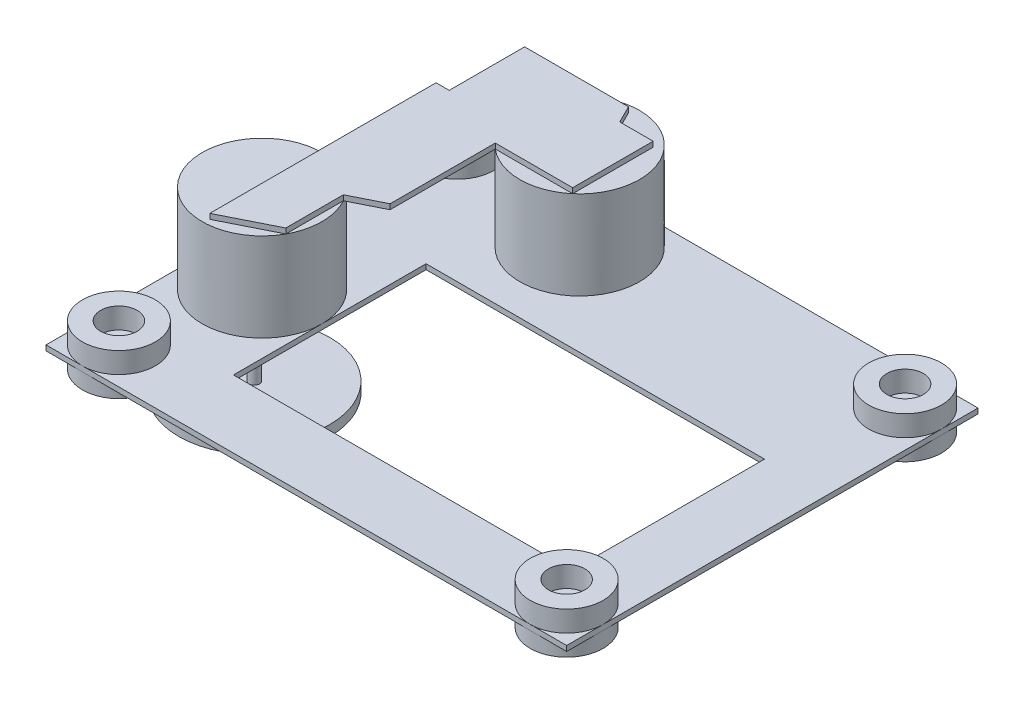
from build123d import *

# Parameters (mm, degrees)
ESQUISSE4_W             = 100
ESQUISSE4_H             = 79
BOSS_EXTRU_3_DEPTH      = 1
BOSS_EXTRU_4_DEPTH      = 4
BOSS_EXTRU_4_DEPTH_BACK = 4
ESQUISSE1_R             = 7
ESQUISSE1_R_2           = 3.5
ESQUISSE6_R             = 11.5
BOSS_EXTRU_5_DEPTH      = 17
BOSS_EXTRU_6_DEPTH      = 1
ESQUISSE8_W             = 65
ESQUISSE8_H             = 37
ENL_V_MAT_EXTRU_1_DEPTH = 1
ESQUISSE9_R             = 1
BOSS_EXTRU_7_DEPTH      = 15
ESQUISSE10_R            = 14.5
BOSS_EXTRU_8_DEPTH      = 2
ESQUISSE11_R            = 7.5
BOSS_EXTRU_9_DEPTH      = 4
CONG_1_R                = 3


with BuildPart() as part:
    # Esquisse4 → Boss.-Extru.3 (new body)
    with BuildSketch(Plane(origin=(0, 0, 0), x_dir=(1, 0, 0), z_dir=(0, 1, 0))):
        Rectangle(ESQUISSE4_W, ESQUISSE4_H)
    extrude(amount=-BOSS_EXTRU_3_DEPTH)

    # Esquisse1 → Boss.-Extru.4 (add, two sides: drawn at the far end of the back side and taken through both)
    # profile 1 of 4: a face of its own
    with BuildSketch(Plane(origin=(0, 0, 0), x_dir=(1, 0, 0), z_dir=(0, 1, 0)).offset(-BOSS_EXTRU_4_DEPTH_BACK)):
        with Locations((-43, -32.5)):
            Circle(ESQUISSE1_R)
        with Locations((-43, -32.5)):
            Circle(ESQUISSE1_R_2, mode=Mode.SUBTRACT)
    # profile 2 of 4: a face of its own
    with BuildSketch(Plane(origin=(0, 0, 0), x_dir=(1, 0, 0), z_dir=(0, 1, 0)).offset(-BOSS_EXTRU_4_DEPTH_BACK)):
        with Locations((43, -32.5)):
            Circle(ESQUISSE1_R)
        with Locations((43, -32.5)):
            Circle(ESQUISSE1_R_2, mode=Mode.SUBTRACT)
    # profile 3 of 4: a face of its own
    with BuildSketch(Plane(origin=(0, 0, 0), x_dir=(1, 0, 0), z_dir=(0, 1, 0)).offset(-BOSS_EXTRU_4_DEPTH_BACK)):
        with Locations((-43, 32.5)):
            Circle(ESQUISSE1_R)
        with Locations((-43, 32.5)):
            Circle(ESQUISSE1_R_2, mode=Mode.SUBTRACT)
    # profile 4 of 4: a face of its own
    with BuildSketch(Plane(origin=(0, 0, 0), x_dir=(1, 0, 0), z_dir=(0, 1, 0)).offset(-BOSS_EXTRU_4_DEPTH_BACK)):
        with Locations((43, 32.5)):
            Circle(ESQUISSE1_R)
        with Locations((43, 32.5)):
            Circle(ESQUISSE1_R_2, mode=Mode.SUBTRACT)
    extrude(amount=BOSS_EXTRU_4_DEPTH + BOSS_EXTRU_4_DEPTH_BACK)

    # Esquisse6 → Boss.-Extru.5 (add)
    with BuildSketch(Plane(origin=(0, 0, 0), x_dir=(1, 0, 0), z_dir=(0, 1, 0))):
        with Locations((-38.5, -9.5)):
            Circle(ESQUISSE6_R)
        with Locations((-15, 28)):
            Circle(ESQUISSE6_R)
    extrude(amount=BOSS_EXTRU_5_DEPTH)

    # Esquisse7 → Boss.-Extru.6 (add)
    with BuildSketch(Plane(origin=(0, 17, 0), x_dir=(1, 0, 0), z_dir=(0, 1, 0))):
        Polygon((-38.143774149, -19.88751618), (-28.414215556, -15.025120102), (-28.414215556, -3.974879898), (-22.428299765, -0.98338823), (-22.428299765, 19.221027247), (-7.571700235, 19.221027247), (-7.571700235, 34.680148422), (-13.988712335, 34.680148422), (-15.667356388, 38.039082045), (-35.613243864, 38.039082045), (-35.613243864, 23.559466539), (-38.143774149, 23.559466539), (-38.143774149, 0), align=None)
    extrude(amount=BOSS_EXTRU_6_DEPTH)

    # Esquisse8 → Enlèv. mat.-Extru.1 (cut)
    with BuildSketch(Plane(origin=(0, 0, 0), x_dir=(1, 0, 0), z_dir=(0, 1, 0))):
        with Locations((5.5, -8)):
            Rectangle(ESQUISSE8_W, ESQUISSE8_H)
    extrude(amount=-ENL_V_MAT_EXTRU_1_DEPTH, mode=Mode.SUBTRACT)

    # Esquisse9 → Boss.-Extru.7 (add)
    with BuildSketch(Plane.XZ.offset(1)):
        with Locations((-40, 9.5)):
            Circle(ESQUISSE9_R)
    extrude(amount=BOSS_EXTRU_7_DEPTH)

    # Esquisse10 → Boss.-Extru.8 (add)
    with BuildSketch(Plane.XZ.offset(16)):
        with Locations((-40, 9.5)):
            Circle(ESQUISSE10_R)
    extrude(amount=BOSS_EXTRU_8_DEPTH)

    # Esquisse11 → Boss.-Extru.9 (add)
    with BuildSketch(Plane(origin=(0, -18, 0), x_dir=(-1, 0, 0), z_dir=(0, -1, 0))):
        with Locations((40, -9.5)):
            Circle(ESQUISSE11_R)
    extrude(amount=BOSS_EXTRU_9_DEPTH)

    # Congé1
    cong_1_edges = [part.edges().sort_by_distance(p)[0] for p in [
        (-32.5, -22, 9.5),
    ]]
    fillet(cong_1_edges, radius=CONG_1_R)


solid = part.part
